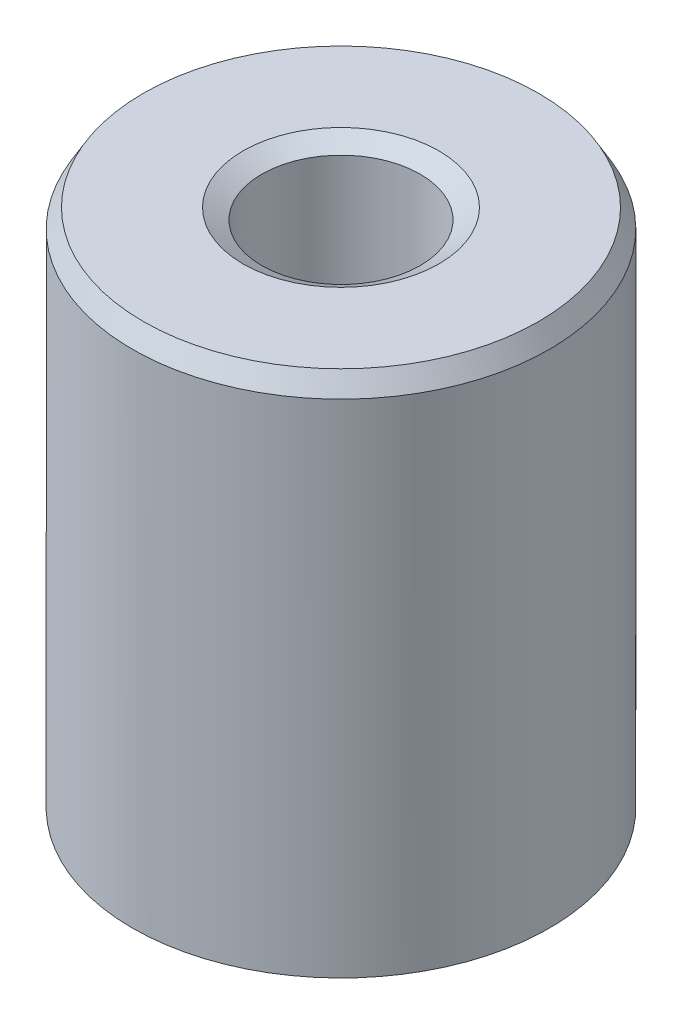
from build123d import *
from OCP.BRepFilletAPI import BRepFilletAPI_MakeChamfer

# Parameters (mm, degrees)
SKETCH1_R           = 15
BOSS_EXTRUDE1_DEPTH = 38.191668577
SKETCH2_R           = 5.701060877
CUT_EXTRUDE1_DEPTH  = 44.687567438
CHAMFER1_SIZE       = 1.345956447
CHAMFER1_SIZE2      = 0.777088317


with BuildPart() as part:
    # Sketch1 → Boss-Extrude1 (new body)
    with BuildSketch(Plane(origin=(0, 0, 0), x_dir=(1, 0, 0), z_dir=(0, 1, 0))):
        Circle(SKETCH1_R)
    extrude(amount=BOSS_EXTRUDE1_DEPTH)

    # Sketch2 → Cut-Extrude1 (cut, through all)
    with BuildSketch(Plane(origin=(0, 0, 0), x_dir=(1, 0, 0), z_dir=(0, 1, 0))):
        Circle(SKETCH2_R)
    extrude(amount=CUT_EXTRUDE1_DEPTH, mode=Mode.SUBTRACT)

    # Chamfer1: one chamfer whose edges measure the first distance from different faces: ONE call of the kernel's chamfer builder (chamfer() names one face for all edges)
    chamfer1_edges_1 = [part.edges().sort_by_distance(p)[0] for p in [
        (-5.701060877, 38.191668577, 0),
    ]]
    chamfer1_side_1 = [part.faces().sort_by_distance(p)[0] for p in [
        (-14.575735931, 38.191668577, 0),
    ]]
    chamfer1_edges_2 = [part.edges().sort_by_distance(p)[0] for p in [
        (-5.701060877, 0, 0),
    ]]
    chamfer1_side_2 = [part.faces().sort_by_distance(p)[0] for p in [
        (-5.701060877, 19.095834288, 0),
    ]]
    chamfer1_edges_3 = [part.edges().sort_by_distance(p)[0] for p in [
        (-15, 0, 0),
    ]]
    chamfer1_side_3 = [part.faces().sort_by_distance(p)[0] for p in [
        (-14.575735931, 0, 0),
    ]]
    chamfer1_edges_4 = [part.edges().sort_by_distance(p)[0] for p in [
        (-15, 38.191668577, 0),
    ]]
    chamfer1_side_4 = [part.faces().sort_by_distance(p)[0] for p in [
        (-15, 19.095834288, 0),
    ]]
    chamfer1 = BRepFilletAPI_MakeChamfer(part.part.solid().wrapped)
    for e in chamfer1_edges_1:
        chamfer1.Add(CHAMFER1_SIZE, CHAMFER1_SIZE2, e.wrapped, chamfer1_side_1[0].wrapped)  # the first distance lies on this face
    for e in chamfer1_edges_2:
        chamfer1.Add(CHAMFER1_SIZE, CHAMFER1_SIZE2, e.wrapped, chamfer1_side_2[0].wrapped)  # the first distance lies on this face
    for e in chamfer1_edges_3:
        chamfer1.Add(CHAMFER1_SIZE, CHAMFER1_SIZE2, e.wrapped, chamfer1_side_3[0].wrapped)  # the first distance lies on this face
    for e in chamfer1_edges_4:
        chamfer1.Add(CHAMFER1_SIZE, CHAMFER1_SIZE2, e.wrapped, chamfer1_side_4[0].wrapped)  # the first distance lies on this face
    add(Compound.cast(chamfer1.Shape()), mode=Mode.REPLACE)


solid = part.part
